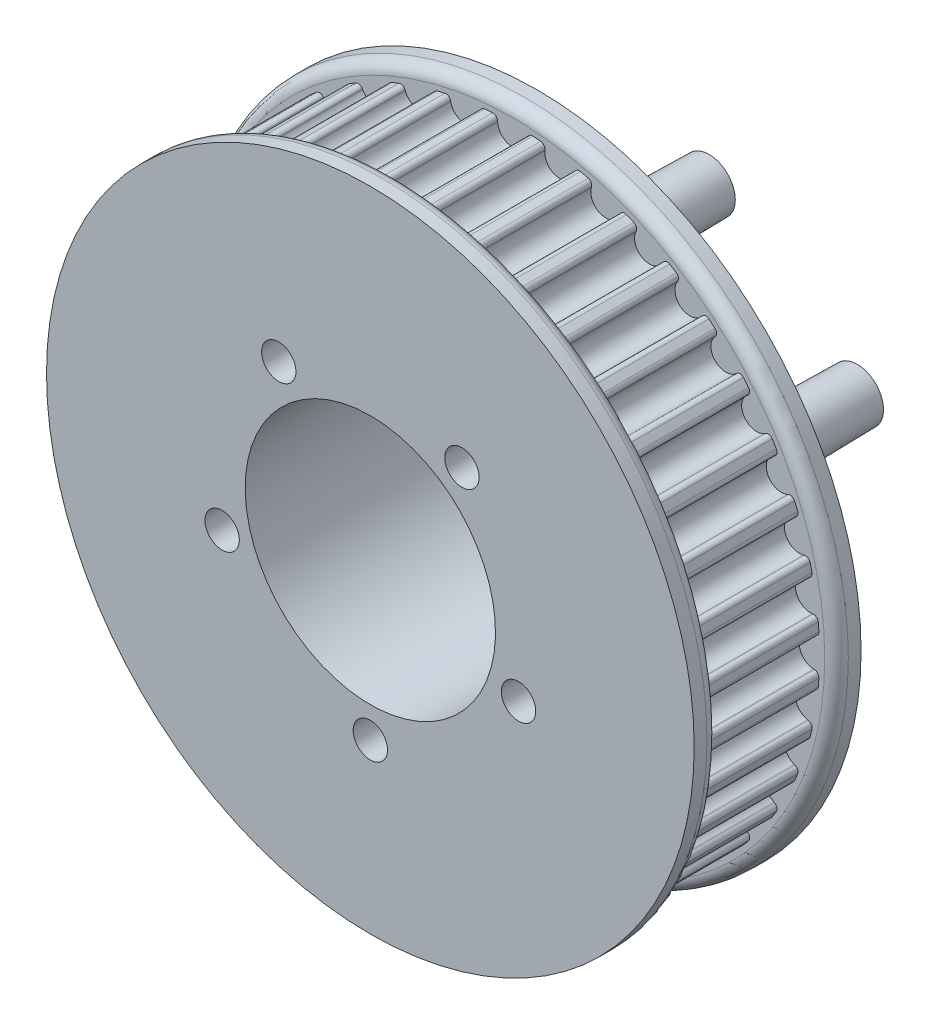
from build123d import *

# Parameters (mm, degrees)
SKETCH_3_R                       = 31.259488618379066
EXTRUDE_2_DEPTH                  = 12
CUT_EXTRUDE_2_DEPTH              = 46.80732755100586
FILLET_1_R                       = 0.48
PATTERN_CIRCULAR_1_COUNT         = 40
FILLET_1_OF_PATTERN_CIRCULAR_1_R = 0.48
SKETCH_8_R                       = 32.98948861837907
EXTRUDE_3_DEPTH                  = 2.5
EXTRUDE_START                    = 2.5
SKETCH_9_R                       = 32.98948861837907
EXTRUDE_4_DEPTH                  = 2.5
SKETCH_10_R                      = 2.675
SKETCH_10_R_2                    = 2.674999999999999
SKETCH_10_R_3                    = 2.6750000000000007
EXTRUDE_5_DEPTH                  = 20
M5X0_8_2_D                       = 3.5
DRAFT_1_ANGLE                    = 1.0000000000000022
SKETCH_4_R                       = 12.75
CUT_EXTRUDE_3_DEPTH              = 56.01740028762841
FILLET_2_R                       = 1.2


with BuildPart() as part:
    # 스케치3 → 보스-돌출2 (new body)
    with BuildSketch(Plane.XY):
        Circle(SKETCH_3_R)
    extrude(amount=EXTRUDE_2_DEPTH)

    # 스케치3<3> → 컷-돌출2 (cut, symmetric)
    with BuildSketch(Plane.XY):
        with BuildLine():
            Line((-1.5617286792044034, 31.220452146231334), (-1.5330831105243496, 30.647799791129046))
            ThreePointArc((-1.5330831105243503, 30.647799791129046), (-2.8e-16, 29.189488618379063), (1.53308311052435, 30.647799791129046))
            Line((1.5330831105243496, 30.647799791129046), (1.5617286792044034, 31.220452146231334))
            ThreePointArc((1.5617286792044034, 31.220452146231334), (-2.2e-16, 31.259488618379066), (-1.5617286792044032, 31.220452146231338))
        make_face()
    cut_extrude_2 = extrude(amount=CUT_EXTRUDE_2_DEPTH, both=True, mode=Mode.SUBTRACT)

    # 필렛1
    fillet_1_edges = [part.edges().sort_by_distance(p)[0] for p in [
        (1.5617286792044034, 31.220452146231338, 6),
        (-1.5617286792044036, 31.220452146231338, 6),
    ]]
    fillet(fillet_1_edges, radius=FILLET_1_R)

    # 원형 패턴1: 컷-돌출2 ×40 about axis
    pattern_circular_1_axis = Axis((0, 0, 12), (0, 0, -1))
    for i in range(1, PATTERN_CIRCULAR_1_COUNT):
        add(cut_extrude_2.rotate(pattern_circular_1_axis, i * 360 / PATTERN_CIRCULAR_1_COUNT), mode=Mode.SUBTRACT)

    # 필렛1 of 원형 패턴1
    fillet_1_of_pattern_circular_1_edges = [part.edges().sort_by_distance(p)[0] for p in [
        (6.42645593743306, 30.591768382471813, 6),
        (3.341453522186593, 31.080384763410464, 6),
        (11.132942522297654, 29.209813752877423, 6),
        (8.162358048212912, 30.175015157831226, 6),
        (15.565299114145375, 27.108616566873266, 6),
        (12.782278229778964, 28.526636533932447, 6),
        (19.614386383536775, 24.3399152726524, 6),
        (17.087456299378566, 26.175837444089506, 6),
        (23.180502363749223, 20.97188448487134, 6),
        (20.971884484871335, 23.180502363749227, 6),
        (26.175837444089506, 17.087456299378566, 6),
        (24.3399152726524, 19.614386383536775, 6),
        (28.526636533932443, 12.782278229778965, 6),
        (27.108616566873263, 15.565299114145377, 6),
        (30.175015157831226, 8.162358048212914, 6),
        (29.209813752877423, 11.132942522297656, 6),
        (31.080384763410464, 3.3414535221865953, 6),
        (30.591768382471813, 6.4264559374330625, 6),
        (31.220452146231338, -1.5617286792044014, 6),
        (31.220452146231338, 1.5617286792044056, 6),
        (30.591768382471813, -6.426455937433058, 6.000000000000001),
        (31.080384763410464, -3.3414535221865913, 6.000000000000001),
        (29.209813752877427, -11.132942522297652, 6),
        (30.17501515783123, -8.16235804821291, 6),
        (27.108616566873266, -15.565299114145374, 6),
        (28.526636533932447, -12.782278229778962, 6),
        (24.3399152726524, -19.614386383536768, 6.000000000000001),
        (26.175837444089506, -17.087456299378562, 6.000000000000001),
        (20.97188448487134, -23.180502363749223, 6),
        (23.180502363749227, -20.971884484871335, 6),
        (17.087456299378573, -26.175837444089503, 6),
        (19.614386383536775, -24.339915272652398, 6),
        (12.782278229778967, -28.526636533932443, 6),
        (15.565299114145379, -27.108616566873263, 6),
        (8.162358048212916, -30.175015157831226, 6),
        (11.132942522297657, -29.209813752877423, 6),
        (3.3414535221865975, -31.08038476341046, 6),
        (6.426455937433063, -30.59176838247181, 6),
        (-1.5617286792043996, -31.220452146231338, 6),
        (1.5617286792044074, -31.220452146231338, 6),
        (-6.426455937433056, -30.591768382471813, 6),
        (-3.3414535221865886, -31.080384763410464, 6),
        (-11.13294252229765, -29.209813752877427, 6),
        (-8.162358048212909, -30.17501515783123, 6),
        (-15.565299114145374, -27.108616566873266, 6.000000000000001),
        (-12.782278229778962, -28.526636533932447, 6.000000000000001),
        (-19.61438638353677, -24.339915272652405, 6.000000000000001),
        (-17.087456299378562, -26.17583744408951, 6.000000000000001),
        (-23.180502363749223, -20.971884484871342, 6),
        (-20.971884484871335, -23.18050236374923, 6),
        (-26.175837444089503, -17.087456299378573, 6),
        (-24.339915272652398, -19.614386383536775, 6),
        (-28.526636533932443, -12.782278229778969, 6),
        (-27.108616566873263, -15.56529911414538, 6),
        (-30.175015157831226, -8.162358048212917, 6.000000000000001),
        (-29.209813752877423, -11.13294252229766, 6.000000000000001),
        (-31.08038476341046, -3.3414535221865993, 6.000000000000001),
        (-30.59176838247181, -6.426455937433065, 6.000000000000001),
        (-31.220452146231338, 1.5617286792043976, 6),
        (-31.220452146231338, -1.5617286792044094, 6),
        (-30.591768382471813, 6.4264559374330545, 6),
        (-31.080384763410464, 3.341453522186587, 6),
        (-29.209813752877427, 11.132942522297649, 6),
        (-30.17501515783123, 8.162358048212907, 6),
        (-27.10861656687327, 15.565299114145372, 6),
        (-28.52663653393245, 12.78227822977896, 6),
        (-24.339915272652405, 19.614386383536768, 6),
        (-26.17583744408951, 17.08745629937856, 6),
        (-20.971884484871342, 23.18050236374922, 6),
        (-23.18050236374923, 20.97188448487133, 6),
        (-17.087456299378577, 26.175837444089503, 6),
        (-19.614386383536782, 24.339915272652398, 6),
        (-12.78227822977897, 28.526636533932443, 6),
        (-15.565299114145382, 27.108616566873263, 6),
        (-8.16235804821292, 30.175015157831226, 6),
        (-11.132942522297661, 29.209813752877423, 6),
        (-3.341453522186602, 31.08038476341046, 6),
        (-6.426455937433069, 30.59176838247181, 6),
    ]]
    fillet(fillet_1_of_pattern_circular_1_edges, radius=FILLET_1_OF_PATTERN_CIRCULAR_1_R)

    # 스케치8 → 보스-돌출3 (add)
    with BuildSketch(Plane.XY.offset(12)):
        Circle(SKETCH_8_R)
    extrude(amount=EXTRUDE_3_DEPTH)

    # 스케치9 → 보스-돌출4 (add)
    with BuildSketch(Plane(origin=(0, 0, 0), x_dir=(-1, 0, 0), z_dir=(0, 0, -1)).offset(EXTRUDE_START)):
        Circle(SKETCH_9_R)
    extrude(amount=-EXTRUDE_4_DEPTH)

    # 스케치7 → 회전2 (revolve)
    with BuildSketch(Plane.ZY):
        with BuildLine():
            Line((-14.659931583815899, 11), (-14.659931583815899, 0))
            Line((-14.659931583815899, 0), (-1.004808498528325, 0))
            Line((-1.0048084985283248, 0), (-1.0048084985283245, 27.097837622782833))
            Line((-1.004808498528325, 27.097837622782833), (-4.8999999999999995, 29.34672748470262))
            ThreePointArc((-4.899999999999993, 29.34672748470262), (-6.4092638367154375, 25.81060883673544), (-7.254808498528332, 22.06))
            ThreePointArc((-7.2548084985283285, 22.06), (-12.637719623884406, 17.655062883028585), (-14.659931583815899, 11))
        make_face()
    revolve(axis=Axis((0, 0, -14.659931583815899), (0, 0, 1)))

    # 스케치10 → 보스-돌출5 (add)
    with BuildSketch(Plane.XY):
        with Locations((0, 15.875)):
            Circle(SKETCH_10_R)
        with Locations((15.098022196185564, 4.905644785702292)):
            Circle(SKETCH_10_R_2)
        with Locations((9.331090880143012, -12.84314478570229)):
            Circle(SKETCH_10_R_3)
        with Locations((-9.33109088014301, -12.843144785702291)):
            Circle(SKETCH_10_R_3)
        with Locations((-15.098022196185564, 4.905644785702288)):
            Circle(SKETCH_10_R_3)
    extrude(amount=-EXTRUDE_5_DEPTH)

    # M5x0.8 탭을 위한 탭 드릴2 (through all)
    with Locations(Plane(origin=(0, 0, 14.5), x_dir=(-1, 0, 0), z_dir=(0, 0, 1))):
        with Locations((-15.098022196, 4.905644786), (0, 15.875), (15.098022196, 4.905644786), (9.33109088, -12.843144786), (-9.33109088, -12.843144786)):
            Hole(M5X0_8_2_D / 2)

    # 구배1
    draft_1_faces = [part.faces().sort_by_distance(p)[0] for p in [
        (12.423022196185565, 4.905644785702292, -15.987966488440785),
        (6.656090880143012, -12.843144785702288, -15.98788555870242),
        (-12.006090880143011, -12.843144785702291, -15.988005003869372),
        (-17.773022196185565, 4.905644785702288, -15.987938251707364),
        (-2.675, 15.875, -15.988111301279222),
    ]]
    draft(draft_1_faces, Plane(origin=(0, 15.875, -20), x_dir=(-1, 0, 0), z_dir=(0, 0, -1)), DRAFT_1_ANGLE)

    # 스케치4 → 컷-돌출3 (cut, through all)
    with BuildSketch(Plane(origin=(0, 0, -14.659931583815899), x_dir=(-1, 0, 0), z_dir=(0, 0, -1))):
        Circle(SKETCH_4_R)
    extrude(amount=-CUT_EXTRUDE_3_DEPTH, mode=Mode.SUBTRACT)

    # 필렛2
    fillet_2_edges = [part.edges().sort_by_distance(p)[0] for p in [
        (-32.98948861837907, 4.04e-15, 12),
        (32.98948861837907, 4.04e-15, 0),
    ]]
    fillet(fillet_2_edges, radius=FILLET_2_R)


solid = part.part
